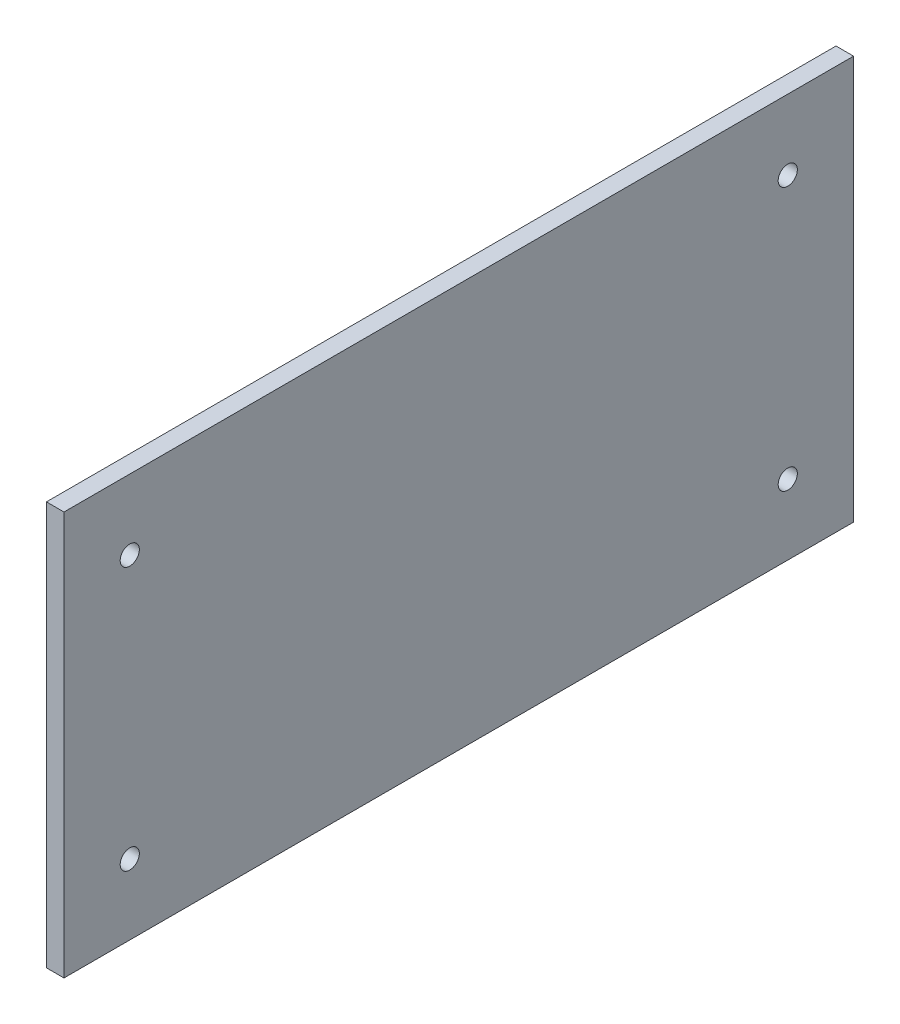
from build123d import *

# Parameters (mm, degrees)
SKETCH1_W           = 90
SKETCH1_H           = 46
BOSS_EXTRUDE1_DEPTH = 2
SKETCH2_R           = 1.0922
CUT_EXTRUDE1_DEPTH  = 10


with BuildPart() as part:
    # Sketch1 → Boss-Extrude1 (new body)
    with BuildSketch(Plane(origin=(0, 0, 0), x_dir=(0, 0, -1), z_dir=(1, 0, 0))):
        Rectangle(SKETCH1_W, SKETCH1_H)
    extrude(amount=BOSS_EXTRUDE1_DEPTH)

    # Sketch2 → Cut-Extrude1 (cut)
    with BuildSketch(Plane(origin=(2, 0, 0), x_dir=(0, 0, -1), z_dir=(1, 0, 0))):
        with Locations((-37.5, -15)):
            Circle(SKETCH2_R)
        with Locations((37.5, -15)):
            Circle(SKETCH2_R)
        with Locations((37.5, 15)):
            Circle(SKETCH2_R)
        with Locations((-37.5, 15)):
            Circle(SKETCH2_R)
    extrude(amount=-CUT_EXTRUDE1_DEPTH, mode=Mode.SUBTRACT)


solid = part.part
